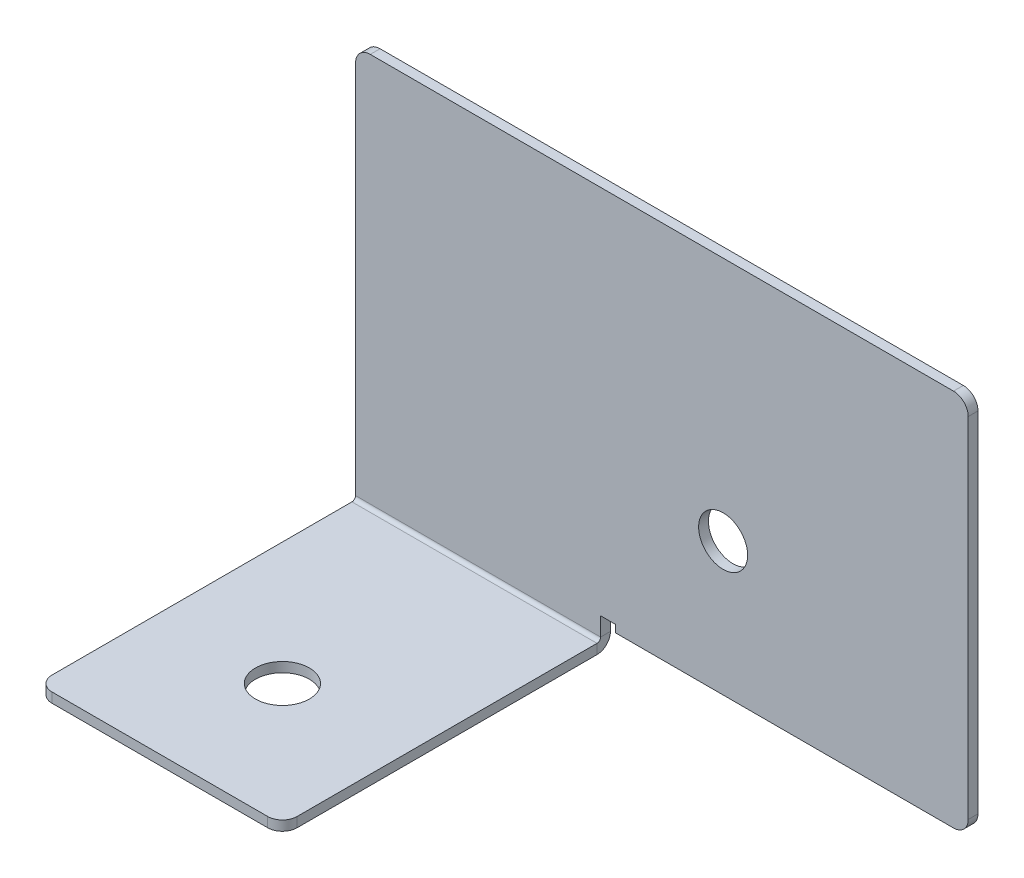
from build123d import *

# Parameters (mm, degrees)
SKETCH2_W          = 125
SKETCH2_H          = 77.2
BASE_FLANGE1_DEPTH = 2
SKETCH2_3_W        = 3
SKETCH2_3_H        = 1.5
CUT_EXTRUDE1_DEPTH = 2
EDGE_FLANGE1_DEPTH = 50
SKETCH2_4_R        = 5
CUT_EXTRUDE2_DEPTH = 2
SKETCH12_R         = 5.5
CUT_EXTRUDE3_DEPTH = 2
FILLET1_R          = 3


# Sheet-metal steps are written as plain solids
with BuildPart() as part:
    # Sketch2 → Base-Flange1 (new body)
    with BuildSketch(Plane.XY):
        Rectangle(SKETCH2_W, SKETCH2_H)
    extrude(amount=-BASE_FLANGE1_DEPTH)

    # Sketch2<3> → Cut-Extrude1 (cut)
    with BuildSketch(Plane.XY):
        with Locations((-11, -37.85)):
            Rectangle(SKETCH2_3_W, SKETCH2_3_H)
    extrude(amount=-CUT_EXTRUDE1_DEPTH, mode=Mode.SUBTRACT)

    # Edge-Flange1 section (across the edge) → Edge-Flange1 (add)
    with BuildSketch(Plane(origin=(-62.5, -43.6, 0), x_dir=(0, 1, 0), z_dir=(1, 0, 0))):
        with BuildLine():
            Line((0, 0.7366), (0, 64.925))
            Line((0, 64.925), (2, 64.925))
            Line((2, 64.925), (2, 0.7366))
            ThreePointArc((2, 0.7366), (2.215745145, 0.215745145), (2.7366, 0))
            Line((2.7366, 0), (5, 0))
            Line((5, 0), (5, -2))
            Line((5, -2), (2.7366, -2))
            ThreePointArc((2.7366, -2), (0.801531583, -1.198468417), (0, 0.7366))
        make_face()
    extrude(amount=EDGE_FLANGE1_DEPTH)

    # Sketch2<4> → Cut-Extrude2 (cut)
    with BuildSketch(Plane.XY):
        with Locations((12.5, -11.4)):
            Circle(SKETCH2_4_R)
    extrude(amount=-CUT_EXTRUDE2_DEPTH, mode=Mode.SUBTRACT)

    # Sketch12 → Cut-Extrude3 (cut)
    with BuildSketch(Plane.XZ.offset(43.6)):
        with Locations(Location((-37.5, 39.925, 0), (0, 0, 270))):
            Circle(SKETCH12_R)
    extrude(amount=-CUT_EXTRUDE3_DEPTH, mode=Mode.SUBTRACT)

    # Fillet1
    fillet1_edges = [part.edges().sort_by_distance(p)[0] for p in [
        (-62.5, -42.6, 64.925),
        (-12.5, -42.6, 64.925),
        (62.5, 38.6, -1),
        (62.5, -38.6, -1),
        (-62.5, 38.6, -1),
    ]]
    fillet(fillet1_edges, radius=FILLET1_R)


solid = part.part
